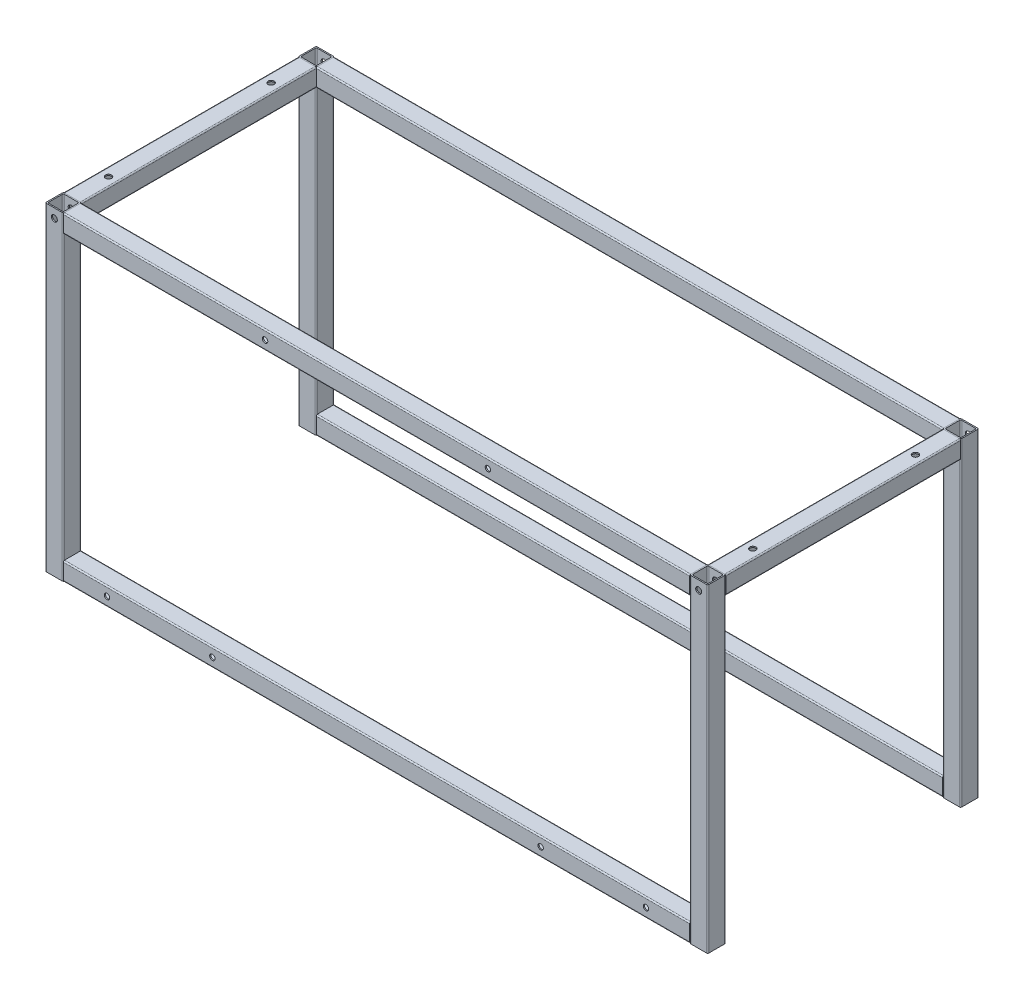
from build123d import *

# Parameters (mm, degrees)
CUSTOM_TUBE_CARRE_30_2_1_DEPTH      = 515
CUSTOM_TUBE_CARRE_30_2_1_DEPTH_BACK = 15
CUSTOM_TUBE_CARRE_30_2_1_2_DEPTH    = 530
CUSTOM_TUBE_CARRE_30_2_1_3_DEPTH    = 1072
CUSTOM_TUBE_CARRE_30_2_1_4_DEPTH    = 1072
CUSTOM_START                        = -520
CUSTOM_TUBE_CARRE_30_2_2_DEPTH      = 1040
CUSTOM_START_2                      = -550
CUSTOM_TUBE_CARRE_30_2_2_2_DEPTH    = 1100
CUSTOM_START_3                      = -235
CUSTOM_TUBE_CARRE_30_2_2_3_DEPTH    = 470
CUSTOM_TUBE_CARRE_30_2_2_4_DEPTH    = 470
CUSTOM_TUBE_CARRE_30_2_2_5_DEPTH    = 420
CUSTOM_TUBE_CARRE_30_2_2_6_DEPTH    = 420
BODY_START                          = 150.147186258
BODY_8_RUN_ON_DEPTH                 = 114.852813742
BODY_7_RUN_ON_DEPTH                 = 114.852813742
BODY_START_2                        = -150.147186258
BODY_7_RUN_ON_2_DEPTH               = 114.852813742
BODY_8_RUN_ON_2_DEPTH               = 114.852813742
ESQUISSE14_W                        = 4.5
ESQUISSE14_H                        = 30
D_GAGEMENT_M81_AT_2_COUNT           = 2
D_GAGEMENT_M81_AT_2_PITCH           = 175
D_GAGEMENT_M81_AT_3_COUNT           = 2
D_GAGEMENT_M81_AT_3_PITCH           = 720
D_GAGEMENT_M81_AT_4_COUNT           = 2
D_GAGEMENT_M81_AT_4_PITCH           = 895
D_GAGEMENT_M82_AT_2_COUNT           = 2
D_GAGEMENT_M82_AT_2_PITCH           = 350
D_GAGEMENT_M82_AT_3_COUNT           = 2
D_GAGEMENT_M82_AT_3_PITCH           = 1070
D_GAGEMENT_M82_AT_4_COUNT           = 2
D_GAGEMENT_M82_AT_4_PITCH           = 720
D_GAGEMENT_M83_AT_2_COUNT           = 2
D_GAGEMENT_M83_AT_2_PITCH           = 270
D_GAGEMENT_M83_AT_3_COUNT           = 2
D_GAGEMENT_M83_AT_3_PITCH           = 1070
D_GAGEMENT_M83_AT_4_COUNT           = 2
D_GAGEMENT_M83_AT_4_PITCH           = 1103.539759139
D_GAGEMENT_M84_AT_2_COUNT           = 2
D_GAGEMENT_M84_AT_2_PITCH           = 1070


with BuildPart() as part:
    # Esquisse11 → Custom TUBE-CARRE-30-2(1) (new, two sides: drawn at the far end of the back side and taken through both)
    with BuildSketch(Plane(origin=(535, -250, 0), x_dir=(-1, 0, 0), z_dir=(0, 1, 0)).offset(-CUSTOM_TUBE_CARRE_30_2_1_DEPTH_BACK)):
        with BuildLine():
            Line((-13, -15), (13, -15))
            ThreePointArc((13, -15), (14.414213562, -14.414213562), (15, -13))
            Line((15, -13), (15, 13))
            ThreePointArc((15, 13), (14.414213562, 14.414213562), (13, 15))
            Line((13, 15), (-13, 15))
            ThreePointArc((-13, 15), (-14.414213562, 14.414213562), (-15, 13))
            Line((-15, 13), (-15, -13))
            ThreePointArc((-15, -13), (-14.414213562, -14.414213562), (-13, -15))
        make_face()
        with BuildLine():
            Line((-11, -13), (11, -13))
            ThreePointArc((11, -13), (12.414213562, -12.414213562), (13, -11))
            Line((13, -11), (13, 11))
            ThreePointArc((13, 11), (12.414213562, 12.414213562), (11, 13))
            Line((11, 13), (-11, 13))
            ThreePointArc((-11, 13), (-12.414213562, 12.414213562), (-13, 11))
            Line((-13, 11), (-13, -11))
            ThreePointArc((-13, -11), (-12.414213562, -12.414213562), (-11, -13))
        make_face(mode=Mode.SUBTRACT)
    extrude(amount=CUSTOM_TUBE_CARRE_30_2_1_DEPTH + CUSTOM_TUBE_CARRE_30_2_1_DEPTH_BACK)


with BuildPart() as body_2:
    # Esquisse11 on segment 2 (carried to segment 2) → Custom TUBE-CARRE-30-2_1 2 (new body)
    with BuildSketch(Plane(origin=(-535, -265, 0), x_dir=(-1, 0, 0), z_dir=(0, 1, 0))):
        with BuildLine():
            Line((-13, -15), (13, -15))
            ThreePointArc((13, -15), (14.414213562, -14.414213562), (15, -13))
            Line((15, -13), (15, 13))
            ThreePointArc((15, 13), (14.414213562, 14.414213562), (13, 15))
            Line((13, 15), (-13, 15))
            ThreePointArc((-13, 15), (-14.414213562, 14.414213562), (-15, 13))
            Line((-15, 13), (-15, -13))
            ThreePointArc((-15, -13), (-14.414213562, -14.414213562), (-13, -15))
        make_face()
        with BuildLine():
            Line((-11, -13), (11, -13))
            ThreePointArc((11, -13), (12.414213562, -12.414213562), (13, -11))
            Line((13, -11), (13, 11))
            ThreePointArc((13, 11), (12.414213562, 12.414213562), (11, 13))
            Line((11, 13), (-11, 13))
            ThreePointArc((-11, 13), (-12.414213562, 12.414213562), (-13, 11))
            Line((-13, 11), (-13, -11))
            ThreePointArc((-13, -11), (-12.414213562, -12.414213562), (-11, -13))
        make_face(mode=Mode.SUBTRACT)
    extrude(amount=CUSTOM_TUBE_CARRE_30_2_1_2_DEPTH)


with BuildPart() as body_3:
    # Esquisse11 on segment 3 (carried to segment 3) → Custom TUBE-CARRE-30-2_1 3 (new body)
    with BuildSketch(Plane(origin=(536, 250, 0), x_dir=(0, -1, 0), z_dir=(-1, 0, 0))):
        with BuildLine():
            Line((-13, -15), (13, -15))
            ThreePointArc((13, -15), (14.414213562, -14.414213562), (15, -13))
            Line((15, -13), (15, 13))
            ThreePointArc((15, 13), (14.414213562, 14.414213562), (13, 15))
            Line((13, 15), (-13, 15))
            ThreePointArc((-13, 15), (-14.414213562, 14.414213562), (-15, 13))
            Line((-15, 13), (-15, -13))
            ThreePointArc((-15, -13), (-14.414213562, -14.414213562), (-13, -15))
        make_face()
        with BuildLine():
            Line((-11, -13), (11, -13))
            ThreePointArc((11, -13), (12.414213562, -12.414213562), (13, -11))
            Line((13, -11), (13, 11))
            ThreePointArc((13, 11), (12.414213562, 12.414213562), (11, 13))
            Line((11, 13), (-11, 13))
            ThreePointArc((-11, 13), (-12.414213562, 12.414213562), (-13, 11))
            Line((-13, 11), (-13, -11))
            ThreePointArc((-13, -11), (-12.414213562, -12.414213562), (-11, -13))
        make_face(mode=Mode.SUBTRACT)
    extrude(amount=CUSTOM_TUBE_CARRE_30_2_1_3_DEPTH)

    # Custom TUBE-CARRE-30-2_1 3 end butt 1
    split(bisect_by=Plane(origin=(520, 250, 0), x_dir=(0, -1, 0), z_dir=(-1, 0, 0)), keep=Keep.TOP)

    # Custom TUBE-CARRE-30-2_1 3 end butt 2
    split(bisect_by=Plane(origin=(-520, 250, 0), x_dir=(0, 1, 0), z_dir=(1, 0, 0)), keep=Keep.TOP)


with BuildPart() as body_4:
    # Esquisse11 on segment 4 (carried to segment 4) → Custom TUBE-CARRE-30-2_1 4 (new body)
    with BuildSketch(Plane(origin=(536, -250, 0), x_dir=(0, -1, 0), z_dir=(-1, 0, 0))):
        with BuildLine():
            Line((-13, -15), (13, -15))
            ThreePointArc((13, -15), (14.414213562, -14.414213562), (15, -13))
            Line((15, -13), (15, 13))
            ThreePointArc((15, 13), (14.414213562, 14.414213562), (13, 15))
            Line((13, 15), (-13, 15))
            ThreePointArc((-13, 15), (-14.414213562, 14.414213562), (-15, 13))
            Line((-15, 13), (-15, -13))
            ThreePointArc((-15, -13), (-14.414213562, -14.414213562), (-13, -15))
        make_face()
        with BuildLine():
            Line((-11, -13), (11, -13))
            ThreePointArc((11, -13), (12.414213562, -12.414213562), (13, -11))
            Line((13, -11), (13, 11))
            ThreePointArc((13, 11), (12.414213562, 12.414213562), (11, 13))
            Line((11, 13), (-11, 13))
            ThreePointArc((-11, 13), (-12.414213562, 12.414213562), (-13, 11))
            Line((-13, 11), (-13, -11))
            ThreePointArc((-13, -11), (-12.414213562, -12.414213562), (-11, -13))
        make_face(mode=Mode.SUBTRACT)
    extrude(amount=CUSTOM_TUBE_CARRE_30_2_1_4_DEPTH)

    # Custom TUBE-CARRE-30-2_1 4 end butt 1
    split(bisect_by=Plane(origin=(520, -250, 0), x_dir=(0, -1, 0), z_dir=(-1, 0, 0)), keep=Keep.TOP)

    # Custom TUBE-CARRE-30-2_1 4 end butt 2
    split(bisect_by=Plane(origin=(-520, -250, 0), x_dir=(0, 1, 0), z_dir=(1, 0, 0)), keep=Keep.TOP)


with BuildPart() as body_5:
    # Custom TUBE-CARRE-30-2(2): read off the stored shape, not the designer's step
    # Custom TUBE-CARRE-30-2(2) outline → Custom TUBE-CARRE-30-2(2) (new body)
    with BuildSketch(Plane.YZ.offset(CUSTOM_START)):
        with BuildLine():
            Line((235, 433), (235, 407))
            ThreePointArc((235, 407), (235.585786438, 405.585786438), (237, 405))
            Line((237, 405), (263, 405))
            ThreePointArc((263, 405), (264.414213562, 405.585786438), (265, 407))
            Line((265, 407), (265, 433))
            ThreePointArc((265, 433), (264.414213562, 434.414213562), (263, 435))
            Line((263, 435), (237, 435))
            ThreePointArc((237, 435), (235.585786438, 434.414213562), (235, 433))
        make_face()
        with BuildLine():
            ThreePointArc((263, 409), (262.414213562, 407.585786438), (261, 407))
            Line((261, 407), (239, 407))
            ThreePointArc((239, 407), (237.585786438, 407.585786438), (237, 409))
            Line((237, 409), (237, 431))
            ThreePointArc((237, 431), (237.585786438, 432.414213562), (239, 433))
            Line((239, 433), (261, 433))
            ThreePointArc((261, 433), (262.414213562, 432.414213562), (263, 431))
            Line((263, 431), (263, 409))
        make_face(mode=Mode.SUBTRACT)
    extrude(amount=CUSTOM_TUBE_CARRE_30_2_2_DEPTH)


with BuildPart() as body_6:
    # Custom TUBE-CARRE-30-2_2 2 outline → Custom TUBE-CARRE-30-2_2 2 (new body)
    with BuildSketch(Plane.YZ.offset(CUSTOM_START_2)):
        with BuildLine():
            ThreePointArc((-265, 407), (-264.414213562, 405.585786438), (-263, 405))
            Line((-263, 405), (-237, 405))
            ThreePointArc((-237, 405), (-235.585786438, 405.585786438), (-235, 407))
            Line((-235, 407), (-235, 433))
            ThreePointArc((-235, 433), (-235.585786438, 434.414213562), (-237, 435))
            Line((-237, 435), (-263, 435))
            ThreePointArc((-263, 435), (-264.414213562, 434.414213562), (-265, 433))
            Line((-265, 433), (-265, 407))
        make_face()
        with BuildLine():
            Line((-239, 407), (-261, 407))
            ThreePointArc((-261, 407), (-262.414213562, 407.585786438), (-263, 409))
            Line((-263, 409), (-263, 431))
            ThreePointArc((-263, 431), (-262.414213562, 432.414213562), (-261, 433))
            Line((-261, 433), (-239, 433))
            ThreePointArc((-239, 433), (-237.585786438, 432.414213562), (-237, 431))
            Line((-237, 431), (-237, 409))
            ThreePointArc((-237, 409), (-237.585786438, 407.585786438), (-239, 407))
        make_face(mode=Mode.SUBTRACT)
    extrude(amount=CUSTOM_TUBE_CARRE_30_2_2_2_DEPTH)

    # Ajuster_Prolonger7 7
    split(bisect_by=Plane(origin=(-520, 15, 420), x_dir=(0, 1, 0), z_dir=(1, 0, 0)), keep=Keep.TOP)

    # Ajuster_Prolonger8 3
    split(bisect_by=Plane(origin=(520, 15, 420), x_dir=(0, -1, 0), z_dir=(-1, 0, 0)), keep=Keep.TOP)

    # Esquisse14 → Dégagement M81 (revolve, cut)
    with BuildSketch(Plane(origin=(447.5, -250, 405), x_dir=(0, 1, 0), z_dir=(1, 0, 0))):
        with Locations((2.25, 15)):
            Rectangle(ESQUISSE14_W, ESQUISSE14_H)
    d_gagement_m81 = revolve(axis=Axis((447.5, -250, 398.65), (0, 0, 1)), mode=Mode.SUBTRACT)

    # Dégagement M81 at 2: Dégagement M81 ×2
    with Locations(*[(-i * D_GAGEMENT_M81_AT_2_PITCH, 0, 0) for i in range(1, D_GAGEMENT_M81_AT_2_COUNT)]):
        add(d_gagement_m81, mode=Mode.SUBTRACT)

    # Dégagement M81 at 3: Dégagement M81 ×2
    with Locations(*[(-i * D_GAGEMENT_M81_AT_3_PITCH, 0, 0) for i in range(1, D_GAGEMENT_M81_AT_3_COUNT)]):
        add(d_gagement_m81, mode=Mode.SUBTRACT)

    # Dégagement M81 at 4: Dégagement M81 ×2
    with Locations(*[(-i * D_GAGEMENT_M81_AT_4_PITCH, 0, 0) for i in range(1, D_GAGEMENT_M81_AT_4_COUNT)]):
        add(d_gagement_m81, mode=Mode.SUBTRACT)


with BuildPart() as body_7:
    # Custom TUBE-CARRE-30-2_2 3 outline → Custom TUBE-CARRE-30-2_2 3 (new body)
    with BuildSketch(Plane(origin=(0, 0, 0), x_dir=(1, 0, 0), z_dir=(0, 1, 0)).offset(CUSTOM_START_3)):
        with BuildLine():
            Line((-522, -405), (-548, -405))
            ThreePointArc((-548, -405), (-549.414213562, -405.585786438), (-550, -407))
            Line((-550, -407), (-550, -433))
            ThreePointArc((-550, -433), (-549.414213562, -434.414213562), (-548, -435))
            Line((-548, -435), (-522, -435))
            ThreePointArc((-522, -435), (-520.585786438, -434.414213562), (-520, -433))
            Line((-520, -433), (-520, -407))
            ThreePointArc((-520, -407), (-520.585786438, -405.585786438), (-522, -405))
        make_face()
        with BuildLine():
            ThreePointArc((-524, -407), (-522.585786438, -407.585786438), (-522, -409))
            Line((-522, -409), (-522, -431))
            ThreePointArc((-522, -431), (-522.585786438, -432.414213562), (-524, -433))
            Line((-524, -433), (-546, -433))
            ThreePointArc((-546, -433), (-547.414213562, -432.414213562), (-548, -431))
            Line((-548, -431), (-548, -409))
            ThreePointArc((-548, -409), (-547.414213562, -407.585786438), (-546, -407))
            Line((-546, -407), (-524, -407))
        make_face(mode=Mode.SUBTRACT)
    extrude(amount=CUSTOM_TUBE_CARRE_30_2_2_3_DEPTH)

    # body 7 cut square before the run-on
    split(bisect_by=Plane.XZ.offset(-150.147186258), keep=Keep.TOP)

    # Custom TUBE-CARRE-30-2_2 3 outline → body 7 run on (add)
    with BuildSketch(Plane(origin=(0, 0, 0), x_dir=(1, 0, 0), z_dir=(0, 1, 0)).offset(BODY_START)):
        with BuildLine():
            Line((-522, -405), (-548, -405))
            ThreePointArc((-548, -405), (-549.414213562, -405.585786438), (-550, -407))
            Line((-550, -407), (-550, -433))
            ThreePointArc((-550, -433), (-549.414213562, -434.414213562), (-548, -435))
            Line((-548, -435), (-522, -435))
            ThreePointArc((-522, -435), (-520.585786438, -434.414213562), (-520, -433))
            Line((-520, -433), (-520, -407))
            ThreePointArc((-520, -407), (-520.585786438, -405.585786438), (-522, -405))
        make_face()
        with BuildLine():
            ThreePointArc((-524, -407), (-522.585786438, -407.585786438), (-522, -409))
            Line((-522, -409), (-522, -431))
            ThreePointArc((-522, -431), (-522.585786438, -432.414213562), (-524, -433))
            Line((-524, -433), (-546, -433))
            ThreePointArc((-546, -433), (-547.414213562, -432.414213562), (-548, -431))
            Line((-548, -431), (-548, -409))
            ThreePointArc((-548, -409), (-547.414213562, -407.585786438), (-546, -407))
            Line((-546, -407), (-524, -407))
        make_face(mode=Mode.SUBTRACT)
    extrude(amount=BODY_7_RUN_ON_DEPTH)

    # body 7 cut square before the run-on
    split(bisect_by=Plane(origin=(0, -150.147186258, 0), x_dir=(-1, 0, 0), z_dir=(0, 1, 0)), keep=Keep.TOP)

    # Custom TUBE-CARRE-30-2_2 3 outline → body 7 run on 2 (add)
    with BuildSketch(Plane(origin=(0, 0, 0), x_dir=(1, 0, 0), z_dir=(0, 1, 0)).offset(BODY_START_2)):
        with BuildLine():
            Line((-522, -405), (-548, -405))
            ThreePointArc((-548, -405), (-549.414213562, -405.585786438), (-550, -407))
            Line((-550, -407), (-550, -433))
            ThreePointArc((-550, -433), (-549.414213562, -434.414213562), (-548, -435))
            Line((-548, -435), (-522, -435))
            ThreePointArc((-522, -435), (-520.585786438, -434.414213562), (-520, -433))
            Line((-520, -433), (-520, -407))
            ThreePointArc((-520, -407), (-520.585786438, -405.585786438), (-522, -405))
        make_face()
        with BuildLine():
            ThreePointArc((-524, -407), (-522.585786438, -407.585786438), (-522, -409))
            Line((-522, -409), (-522, -431))
            ThreePointArc((-522, -431), (-522.585786438, -432.414213562), (-524, -433))
            Line((-524, -433), (-546, -433))
            ThreePointArc((-546, -433), (-547.414213562, -432.414213562), (-548, -431))
            Line((-548, -431), (-548, -409))
            ThreePointArc((-548, -409), (-547.414213562, -407.585786438), (-546, -407))
            Line((-546, -407), (-524, -407))
        make_face(mode=Mode.SUBTRACT)
    extrude(amount=-BODY_7_RUN_ON_2_DEPTH)

    # Esquisse16 → Dégagement M82 (revolve, cut)
    with BuildSketch(Plane(origin=(-535, 250, 465), x_dir=(0, -1, 0), z_dir=(1, 0, 0))):
        Polygon((0, 0), (0, 62.703872786), (4.5, 60), (4.5, 0), align=None)
    d_gagement_m82 = revolve(axis=Axis((-535, 250, 471.35), (0, 0, -1)), mode=Mode.SUBTRACT)


with BuildPart() as body_8:
    # Custom TUBE-CARRE-30-2_2 4 outline → Custom TUBE-CARRE-30-2_2 4 (new body)
    with BuildSketch(Plane(origin=(0, 0, 0), x_dir=(1, 0, 0), z_dir=(0, 1, 0)).offset(CUSTOM_START_3)):
        with BuildLine():
            Line((548, -405), (522, -405))
            ThreePointArc((522, -405), (520.585786438, -405.585786438), (520, -407))
            Line((520, -407), (520, -433))
            ThreePointArc((520, -433), (520.585786438, -434.414213562), (522, -435))
            Line((522, -435), (548, -435))
            ThreePointArc((548, -435), (549.414213562, -434.414213562), (550, -433))
            Line((550, -433), (550, -407))
            ThreePointArc((550, -407), (549.414213562, -405.585786438), (548, -405))
        make_face()
        with BuildLine():
            ThreePointArc((546, -407), (547.414213562, -407.585786438), (548, -409))
            Line((548, -409), (548, -431))
            ThreePointArc((548, -431), (547.414213562, -432.414213562), (546, -433))
            Line((546, -433), (524, -433))
            ThreePointArc((524, -433), (522.585786438, -432.414213562), (522, -431))
            Line((522, -431), (522, -409))
            ThreePointArc((522, -409), (522.585786438, -407.585786438), (524, -407))
            Line((524, -407), (546, -407))
        make_face(mode=Mode.SUBTRACT)
    extrude(amount=CUSTOM_TUBE_CARRE_30_2_2_4_DEPTH)

    # body 8 cut square before the run-on
    split(bisect_by=Plane.XZ.offset(-150.147186258), keep=Keep.TOP)

    # Custom TUBE-CARRE-30-2_2 4 outline → body 8 run on (add)
    with BuildSketch(Plane(origin=(0, 0, 0), x_dir=(1, 0, 0), z_dir=(0, 1, 0)).offset(BODY_START)):
        with BuildLine():
            Line((548, -405), (522, -405))
            ThreePointArc((522, -405), (520.585786438, -405.585786438), (520, -407))
            Line((520, -407), (520, -433))
            ThreePointArc((520, -433), (520.585786438, -434.414213562), (522, -435))
            Line((522, -435), (548, -435))
            ThreePointArc((548, -435), (549.414213562, -434.414213562), (550, -433))
            Line((550, -433), (550, -407))
            ThreePointArc((550, -407), (549.414213562, -405.585786438), (548, -405))
        make_face()
        with BuildLine():
            ThreePointArc((546, -407), (547.414213562, -407.585786438), (548, -409))
            Line((548, -409), (548, -431))
            ThreePointArc((548, -431), (547.414213562, -432.414213562), (546, -433))
            Line((546, -433), (524, -433))
            ThreePointArc((524, -433), (522.585786438, -432.414213562), (522, -431))
            Line((522, -431), (522, -409))
            ThreePointArc((522, -409), (522.585786438, -407.585786438), (524, -407))
            Line((524, -407), (546, -407))
        make_face(mode=Mode.SUBTRACT)
    extrude(amount=BODY_8_RUN_ON_DEPTH)

    # body 8 cut square before the run-on
    split(bisect_by=Plane(origin=(0, -150.147186258, 0), x_dir=(-1, 0, 0), z_dir=(0, 1, 0)), keep=Keep.TOP)

    # Custom TUBE-CARRE-30-2_2 4 outline → body 8 run on 2 (add)
    with BuildSketch(Plane(origin=(0, 0, 0), x_dir=(1, 0, 0), z_dir=(0, 1, 0)).offset(BODY_START_2)):
        with BuildLine():
            Line((548, -405), (522, -405))
            ThreePointArc((522, -405), (520.585786438, -405.585786438), (520, -407))
            Line((520, -407), (520, -433))
            ThreePointArc((520, -433), (520.585786438, -434.414213562), (522, -435))
            Line((522, -435), (548, -435))
            ThreePointArc((548, -435), (549.414213562, -434.414213562), (550, -433))
            Line((550, -433), (550, -407))
            ThreePointArc((550, -407), (549.414213562, -405.585786438), (548, -405))
        make_face()
        with BuildLine():
            ThreePointArc((546, -407), (547.414213562, -407.585786438), (548, -409))
            Line((548, -409), (548, -431))
            ThreePointArc((548, -431), (547.414213562, -432.414213562), (546, -433))
            Line((546, -433), (524, -433))
            ThreePointArc((524, -433), (522.585786438, -432.414213562), (522, -431))
            Line((522, -431), (522, -409))
            ThreePointArc((522, -409), (522.585786438, -407.585786438), (524, -407))
            Line((524, -407), (546, -407))
        make_face(mode=Mode.SUBTRACT)
    extrude(amount=-BODY_8_RUN_ON_2_DEPTH)

    # Dégagement M82 at 3: Dégagement M82 ×2
    with Locations(*[(i * D_GAGEMENT_M82_AT_3_PITCH, 0, 0) for i in range(1, D_GAGEMENT_M82_AT_3_COUNT)]):
        add(d_gagement_m82, mode=Mode.SUBTRACT)


with BuildPart() as body_9:
    # Custom TUBE-CARRE-30-2_2 5 outline → Custom TUBE-CARRE-30-2_2 5 (new body)
    with BuildSketch(Plane.XY):
        with BuildLine():
            ThreePointArc((548, 235), (549.414213562, 235.585786438), (550, 237))
            Line((550, 237), (550, 263))
            ThreePointArc((550, 263), (549.414213562, 264.414213562), (548, 265))
            Line((548, 265), (522, 265))
            ThreePointArc((522, 265), (520.585786438, 264.414213562), (520, 263))
            Line((520, 263), (520, 237))
            ThreePointArc((520, 237), (520.585786438, 235.585786438), (522, 235))
            Line((522, 235), (548, 235))
        make_face()
        with BuildLine():
            Line((548, 261), (548, 239))
            ThreePointArc((548, 239), (547.414213562, 237.585786438), (546, 237))
            Line((546, 237), (524, 237))
            ThreePointArc((524, 237), (522.585786438, 237.585786438), (522, 239))
            Line((522, 239), (522, 261))
            ThreePointArc((522, 261), (522.585786438, 262.414213562), (524, 263))
            Line((524, 263), (546, 263))
            ThreePointArc((546, 263), (547.414213562, 262.414213562), (548, 261))
        make_face(mode=Mode.SUBTRACT)
    extrude(amount=CUSTOM_TUBE_CARRE_30_2_2_5_DEPTH)

    # Ajuster_Prolonger2 3
    split(bisect_by=Plane(origin=(535, 0, 15), x_dir=(0, -1, 0), z_dir=(0, 0, 1)), keep=Keep.TOP)

    # Ajuster/Prolonger3
    split(bisect_by=Plane(origin=(535, 0, 405), x_dir=(0, 1, 0), z_dir=(0, 0, -1)), keep=Keep.TOP)


with BuildPart() as body_10:
    # Custom TUBE-CARRE-30-2_2 6 outline → Custom TUBE-CARRE-30-2_2 6 (new body)
    with BuildSketch(Plane.XY):
        with BuildLine():
            ThreePointArc((-522, 235), (-520.585786438, 235.585786438), (-520, 237))
            Line((-520, 237), (-520, 263))
            ThreePointArc((-520, 263), (-520.585786438, 264.414213562), (-522, 265))
            Line((-522, 265), (-548, 265))
            ThreePointArc((-548, 265), (-549.414213562, 264.414213562), (-550, 263))
            Line((-550, 263), (-550, 237))
            ThreePointArc((-550, 237), (-549.414213562, 235.585786438), (-548, 235))
            Line((-548, 235), (-522, 235))
        make_face()
        with BuildLine():
            Line((-522, 261), (-522, 239))
            ThreePointArc((-522, 239), (-522.585786438, 237.585786438), (-524, 237))
            Line((-524, 237), (-546, 237))
            ThreePointArc((-546, 237), (-547.414213562, 237.585786438), (-548, 239))
            Line((-548, 239), (-548, 261))
            ThreePointArc((-548, 261), (-547.414213562, 262.414213562), (-546, 263))
            Line((-546, 263), (-524, 263))
            ThreePointArc((-524, 263), (-522.585786438, 262.414213562), (-522, 261))
        make_face(mode=Mode.SUBTRACT)
    extrude(amount=CUSTOM_TUBE_CARRE_30_2_2_6_DEPTH)

    # Ajuster_Prolonger1 3
    split(bisect_by=Plane(origin=(-535, 0, 15), x_dir=(0, -1, 0), z_dir=(0, 0, 1)), keep=Keep.TOP)

    # Ajuster/Prolonger4
    split(bisect_by=Plane(origin=(-535, 0, 405), x_dir=(0, 1, 0), z_dir=(0, 0, -1)), keep=Keep.TOP)

    # Esquisse18 → Dégagement M83 (revolve, cut)
    with BuildSketch(Plane(origin=(-535, 235, 75), x_dir=(0, 0, -1), z_dir=(1, 0, 0))):
        Polygon((0, 0), (0, 123.004303095), (5, 120), (5, 0), align=None)
    d_gagement_m83 = revolve(axis=Axis((-535, 228.65, 75), (0, 1, 0)), mode=Mode.SUBTRACT)

    # Dégagement M83 at 2: Dégagement M83 ×2
    with Locations(*[(0, 0, i * D_GAGEMENT_M83_AT_2_PITCH) for i in range(1, D_GAGEMENT_M83_AT_2_COUNT)]):
        add(d_gagement_m83, mode=Mode.SUBTRACT)


with BuildPart() as body_5_1:
    add(body_5.part)

    # Dégagement M82 at 2: Dégagement M82 ×2
    with Locations(*[(i * D_GAGEMENT_M82_AT_2_PITCH, 0, 0) for i in range(1, D_GAGEMENT_M82_AT_2_COUNT)]):
        add(d_gagement_m82, mode=Mode.SUBTRACT)

    # Dégagement M82 at 4: Dégagement M82 ×2
    with Locations(*[(i * D_GAGEMENT_M82_AT_4_PITCH, 0, 0) for i in range(1, D_GAGEMENT_M82_AT_4_COUNT)]):
        add(d_gagement_m82, mode=Mode.SUBTRACT)


with BuildPart() as body_9_1:
    add(body_9.part)

    # Dégagement M83 at 3: Dégagement M83 ×2
    with Locations(*[(i * D_GAGEMENT_M83_AT_3_PITCH, 0, 0) for i in range(1, D_GAGEMENT_M83_AT_3_COUNT)]):
        add(d_gagement_m83, mode=Mode.SUBTRACT)

    # Dégagement M83 at 4: Dégagement M83 ×2
    with Locations(*[Vector(0.9696071130550645, 0, 0.2446672154438012) * (i * D_GAGEMENT_M83_AT_4_PITCH) for i in range(1, D_GAGEMENT_M83_AT_4_COUNT)]):
        add(d_gagement_m83, mode=Mode.SUBTRACT)


with BuildPart() as d_gagement_m84_tool:
    # Esquisse20 → Dégagement M84 (revolve)
    with BuildSketch(Plane(origin=(535, 250, 465), x_dir=(0, -1, 0), z_dir=(1, 0, 0))):
        Polygon((0, 0), (0, 503.004303095), (5, 500), (5, 0), align=None)
    d_gagement_m84 = revolve(axis=Axis((535, 250, 471.35), (0, 0, -1)))


with BuildPart() as part_1:
    add(part.part)

    # Dégagement M84: cut by d_gagement_m84_tool
    add(d_gagement_m84_tool.part, mode=Mode.SUBTRACT)


with BuildPart() as body_8_1:
    add(body_8.part)

    # Dégagement M84: cut by d_gagement_m84_tool
    add(d_gagement_m84_tool.part, mode=Mode.SUBTRACT)


with BuildPart() as d_gagement_m84_at_2_tool:
    # Dégagement M84 at 2: Dégagement M84 ×2
    with Locations(*[(-i * D_GAGEMENT_M84_AT_2_PITCH, 0, 0) for i in range(1, D_GAGEMENT_M84_AT_2_COUNT)]):
        add(d_gagement_m84)


with BuildPart() as body_2_1:
    add(body_2.part)

    # Dégagement M84 at 2: cut by d_gagement_m84_at_2_tool
    add(d_gagement_m84_at_2_tool.part, mode=Mode.SUBTRACT)


with BuildPart() as body_7_1:
    add(body_7.part)

    # Dégagement M84 at 2: cut by d_gagement_m84_at_2_tool
    add(d_gagement_m84_at_2_tool.part, mode=Mode.SUBTRACT)


solid = Compound([body_3.part, body_4.part, body_6.part, body_10.part, body_5_1.part, body_9_1.part, part_1.part, body_8_1.part, body_2_1.part, body_7_1.part])
